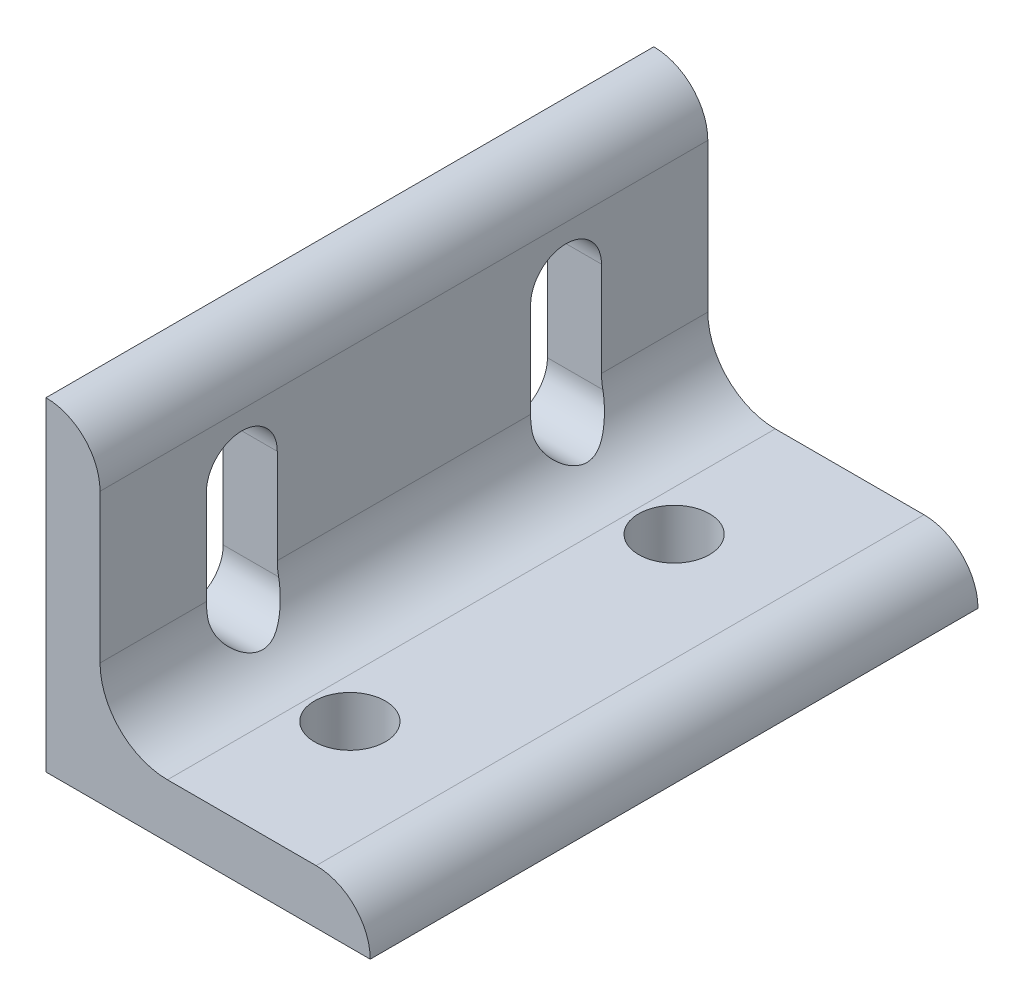
from build123d import *

# Parameters (mm, degrees)
BOSS_EXTRUDE1_DEPTH = 35.7124
FILLET1_R           = 6.35
CUT_EXTRUDE1_DEPTH  = 65.64205685
CUT_EXTRUDE2_REACH  = 66.642
SKETCH4_R           = 4.1656


with BuildPart() as part:
    # Sketch2 → Boss-Extrude1 (new, symmetric)
    with BuildSketch(Plane.XY):
        with BuildLine():
            Line((0, 0), (0, 38.1))
            Line((0, 38.1), (6.35, 38.1))
            Line((6.35, 38.1), (6.35, 14.2748))
            ThreePointArc((6.35, 14.2748), (8.67112018, 8.67112018), (14.2748, 6.35))
            Line((14.2748, 6.35), (38.1, 6.35))
            Line((38.1, 6.35), (38.1, 0))
            Line((38.1, 0), (0, 0))
        make_face()
    extrude(amount=BOSS_EXTRUDE1_DEPTH, both=True)

    # Fillet1
    fillet1_edges = [part.edges().sort_by_distance(p)[0] for p in [
        (38.1, 6.35, 0),
        (6.35, 38.1, 0),
    ]]
    fillet(fillet1_edges, radius=FILLET1_R - 0.0001)  # a hair under: the kernel refuses the full size

    # Sketch3 → Cut-Extrude1 (cut, through all)
    with BuildSketch(Plane.ZY):
        with BuildLine():
            Line((-23.2156, 25.4), (-23.2156, 12.7))
            ThreePointArc((-23.2156, 12.7), (-19.05, 8.5344), (-14.8844, 12.7))
            Line((-14.8844, 12.7), (-14.8844, 25.4))
            ThreePointArc((-14.8844, 25.4), (-19.05, 29.5656), (-23.2156, 25.4))
        make_face()
        with BuildLine():
            Line((14.8844, 12.7), (14.8844, 25.4))
            ThreePointArc((14.8844, 25.4), (19.05, 29.5656), (23.2156, 25.4))
            Line((23.2156, 25.4), (23.2156, 12.7))
            ThreePointArc((23.2156, 12.7), (19.05, 8.5344), (14.8844, 12.7))
        make_face()
    extrude(amount=-CUT_EXTRUDE1_DEPTH, mode=Mode.SUBTRACT)

    # Sketch4 → Cut-Extrude2 (cut, up to next)
    with BuildSketch(Plane.XZ, mode=Mode.PRIVATE) as cut_extrude2_sk1:
        with Locations((19.05, -19.05)):
            Circle(SKETCH4_R)
    cut_extrude2_tool1 = extrude(cut_extrude2_sk1.sketch, amount=-CUT_EXTRUDE2_REACH, mode=Mode.PRIVATE) & part.part
    # Sketch4 → Cut-Extrude2 (cut, up to next)
    with BuildSketch(Plane.XZ, mode=Mode.PRIVATE) as cut_extrude2_sk2:
        with Locations((19.05, 19.05)):
            Circle(SKETCH4_R)
    cut_extrude2_tool2 = extrude(cut_extrude2_sk2.sketch, amount=-CUT_EXTRUDE2_REACH, mode=Mode.PRIVATE) & part.part
    add(cut_extrude2_tool1.solids().sort_by_distance((19.05, 0, -19.05))[0], mode=Mode.SUBTRACT)
    add(cut_extrude2_tool2.solids().sort_by_distance((19.05, 0, 19.05))[0], mode=Mode.SUBTRACT)


solid = part.part
